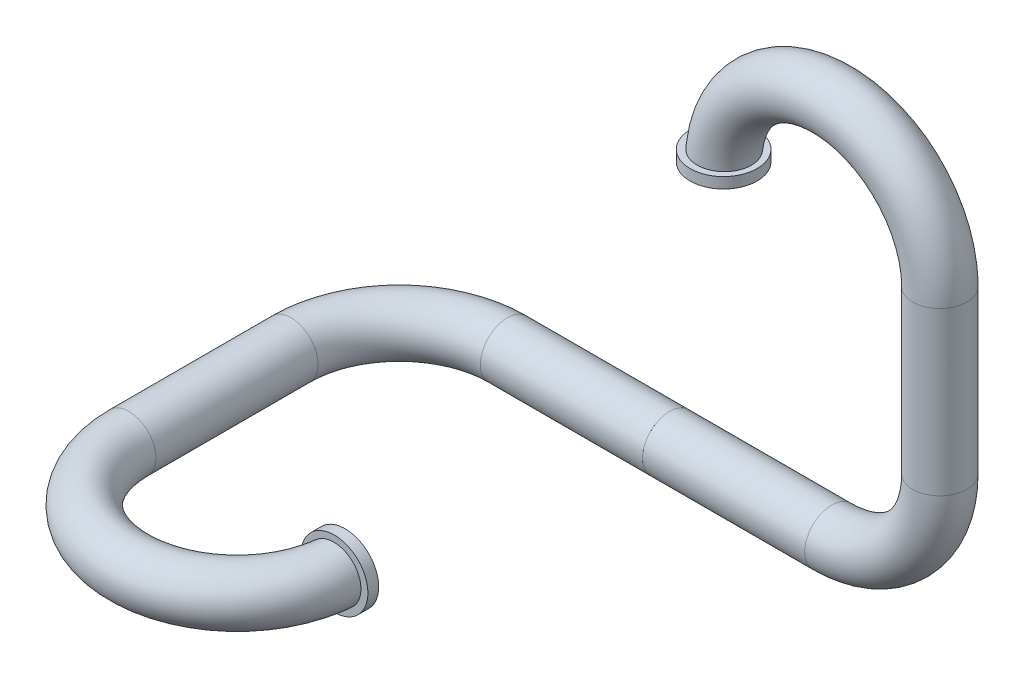
from build123d import *

# Parameters (mm, degrees)
SKETCH3_R             = 0.25
SKETCH3_R_2           = 0.2
SKETCH6_R             = 0.31
SKETCH6_R_2           = 0.21
BODY_MOVE_COPY1_ANGLE = 90


# Read off the part's stored shape, not the designer's step: Split1
with BuildPart() as part:
    # Sweep-Thin1: sweep along a path in Sketch1
    with BuildLine(Plane.XY) as sweep_thin1_path:
        Line((0.5, -2.5), (-1, -2.5))
        ThreePointArc((-1, -2.5), (-1.707106781, -2.207106781), (-2, -1.5))
        Line((-2, -1.5), (-2, 0))
        ThreePointArc((-2, 0), (-1, 1), (0, 0))
    # Sketch3 → Sweep-Thin1 (sweep)
    with BuildSketch(Plane(origin=(0, 0, 0), x_dir=(1, 0, 0), z_dir=(0, 1, 0))):
        Circle(SKETCH3_R)
        Circle(SKETCH3_R_2, mode=Mode.SUBTRACT)
    sweep(path=sweep_thin1_path.line)

    # Sweep-Thin2: sweep along a path in Sketch5
    with BuildLine(Plane.XY) as sweep_thin2_path:
        Line((0, 0), (0, 0.1))
    # Sketch6 → Sweep-Thin2 (sweep)
    with BuildSketch(Plane(origin=(0, 0, 0), x_dir=(1, 0, 0), z_dir=(0, 1, 0))):
        Circle(SKETCH6_R)
        Circle(SKETCH6_R_2, mode=Mode.SUBTRACT)
    sweep(path=sweep_thin2_path.line)

    # Mirror2: part across plane


with BuildPart() as part_1:
    add(part.part)
    add(part.part.mirror(Plane(origin=(0.5, -2.5, 0), x_dir=(0, 0, 1), z_dir=(1, 0, 0))))


with BuildPart() as body_2:
    # Split1: the piece on the far side of the plane
    add(part_1.part)
    split(bisect_by=Plane.YZ.offset(0.5), keep=Keep.BOTTOM)


with BuildPart() as part_2:
    add(part_1.part)

    # Split1
    split(bisect_by=Plane.YZ.offset(0.5), keep=Keep.TOP)


with BuildPart() as body_2_1:
    # Body-Move/Copy1: moved
    add(body_2.part.rotate(Axis((0, -2.5, 0), (1, 0, 0)), BODY_MOVE_COPY1_ANGLE))


solid = Compound([part_2.part, body_2_1.part])
